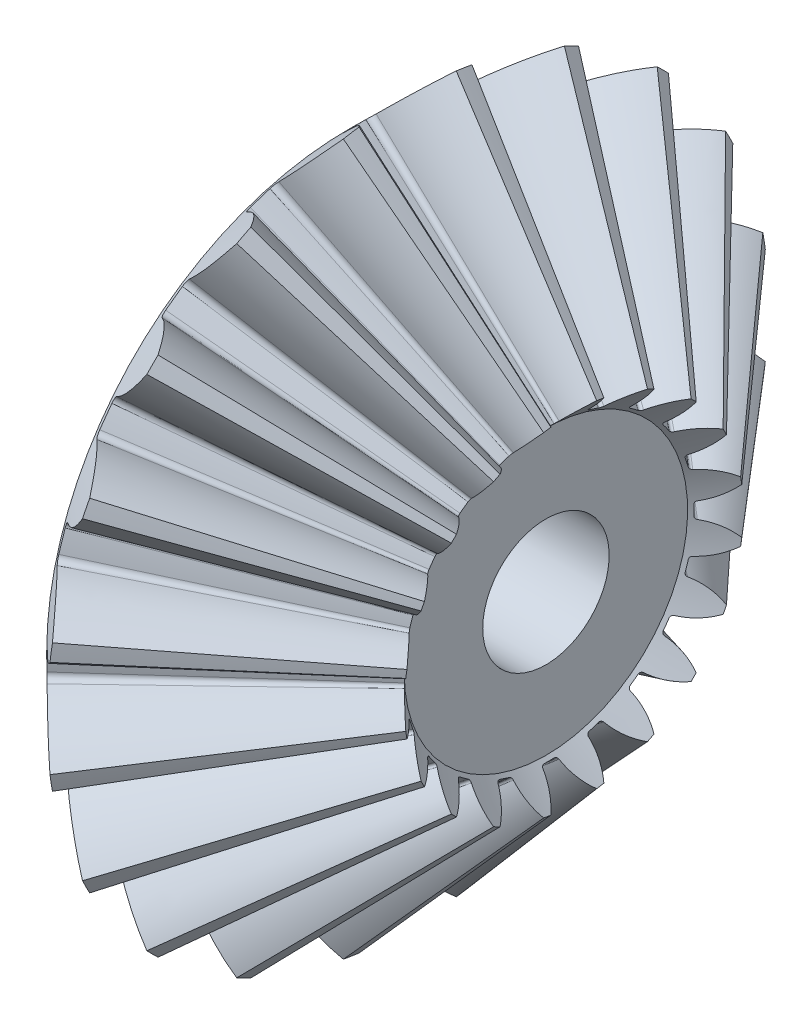
from build123d import *

# Parameters (mm, degrees)
TEETHCUTS_COUNT = 20
TEETHCUTS_ANGLE = 342
HUBSKE_R        = 5
HUB_DEPTH       = 0.0001016
BORSKE_R        = 1.5
BORE_DEPTH      = 8.84097754


with BuildPart() as part:
    # BasProSke → Base-Revolve (revolve)
    with BuildSketch(Plane(origin=(0, 0, 0), x_dir=(1, 0, 0), z_dir=(0, 1, 0)), mode=Mode.PRIVATE) as base_revolve_sk:
        Polygon((0, 0), (0, 7.159073261), (1.406612166, 8.565685424), (5.349252849, 4.023044734), (4.688609434, 3.36240132), (4.688609434, 0), align=None)
    revolve(base_revolve_sk.sketch.rotate(Axis((-10, 0, 0), (1, 0, 0)), 180), axis=Axis((-10, 0, 0), (1, 0, 0)))

    # ToothCut: read off the stored shape, not the designer's step
    # ToothCut: loft between two sections, ruled curve by curve
    toothcut_from = [
        Edge.make_bspline([(8.846968182, 0.006041442, -0.009396371), (8.842747294, 0.001820554, -0.014824058), (8.837070599, -0.003856141, -0.014022911), (8.833691402, -0.007235338, -0.007522631)], [0, 0, 0, 0, 1, 1, 1, 1], 3, [1, 0.779607321, 0.779607321, 1]),
        Edge.make_bspline([(8.833691402, -0.007235338, 0.007522631), (8.837070599, -0.003856141, 0.014022911), (8.842747294, 0.001820554, 0.014824058), (8.846968182, 0.006041442, 0.009396371)], [0, 0, 0, 0, 1, 1, 1, 1], 3, [1, 0.779607321, 0.779607321, 1]),
        Edge.make_bspline([(8.833691402, -0.007235338, -0.007522631), (8.833188772, -0.007737968, -0.006555763), (8.832787408, -0.008139332, -0.005498444), (8.832495307, -0.008431433, -0.00437174)], [0, 0, 0, 0, 1, 1, 1, 1], 3, [1, 0.993359051, 0.993359051, 1]),
        Edge.make_bspline([(8.832495307, -0.008431433, 0.00437174), (8.832787408, -0.008139332, 0.005498444), (8.833188772, -0.007737968, 0.006555763), (8.833691402, -0.007235338, 0.007522631)], [0, 0, 0, 0, 1, 1, 1, 1], 3, [1, 0.993359051, 0.993359051, 1]),
        Edge.make_bspline([(8.832495307, -0.008431433, -0.00437174), (8.831755763, -0.009170977, -0.001519142), (8.831755763, -0.009170977, 0.001519142), (8.832495307, -0.008431433, 0.00437174)], [0, 0, 0, 0, 1, 1, 1, 1], 3, [1, 0.959256539, 0.959256539, 1]),
        Edge.make_line((8.846968182, 0.006041442, 0.009396371), (8.846968182, 0.006041442, -0.009396371)),
    ]
    toothcut_to = [
        Edge.make_bspline([(1.46556069, 8.624633948, -1.28623016), (1.133128031, 8.29220129, -0.817842922), (0.716323315, 7.875396575, -0.512954078), (0.25391972, 7.412992981, -0.399925851)], [0, 0, 0, 0, 1, 1, 1, 1], 3, [1, 0.968991732, 0.968991732, 1]),
        Edge.make_bspline([(0.25391972, 7.412992981, 0.399925851), (0.716323315, 7.875396575, 0.512954078), (1.133128031, 8.29220129, 0.817842922), (1.46556069, 8.624633948, 1.28623016)], [0, 0, 0, 0, 1, 1, 1, 1], 3, [1, 0.968991732, 0.968991732, 1]),
        Edge.make_bspline([(0.25391972, 7.412992981, -0.399925851), (0.198607772, 7.357681033, -0.386405603), (0.16320738, 7.322280641, -0.324800046), (0.165162164, 7.324235425, -0.245465452)], [0, 0, 0, 0, 1, 1, 1, 1], 3, [1, 0.835749277, 0.835749277, 1]),
        Edge.make_bspline([(0.165162164, 7.324235425, 0.245465452), (0.16320738, 7.322280641, 0.324800046), (0.198607772, 7.357681033, 0.386405603), (0.25391972, 7.412992981, 0.399925851)], [0, 0, 0, 0, 1, 1, 1, 1], 3, [1, 0.835749277, 0.835749277, 1]),
        Edge.make_bspline([(0.165162164, 7.324235425, -0.245465452), (0.169193484, 7.328266745, -0.081854918), (0.169193484, 7.328266745, 0.081854918), (0.165162164, 7.324235425, 0.245465452)], [0, 0, 0, 0, 1, 1, 1, 1], 3, [1, 0.999595624, 0.999595624, 1]),
        Edge.make_line((1.46556069, 8.624633948, 1.28623016), (1.46556069, 8.624633948, -1.28623016)),
    ]
    toothcut = Solid(Shell([*[Face.make_surface_from_curves(toothcut_from[k], toothcut_to[k]) for k in range(6)], Face(Wire(toothcut_from)), Face(Wire(toothcut_to))]))
    add(toothcut, mode=Mode.SUBTRACT)

    # TeethCuts: ToothCut ×20 about axis
    teethcuts_axis = Axis((-10, 0, 0), (1, 0, 0))
    for i in range(1, TEETHCUTS_COUNT):
        add(toothcut.rotate(teethcuts_axis, i * TEETHCUTS_ANGLE / (TEETHCUTS_COUNT - 1)), mode=Mode.SUBTRACT)

    # HubSke → Hub (add)
    with BuildSketch(Plane.ZY):
        with Locations(Location((0, 0, 0), (0, 0, 180))):
            Circle(HUBSKE_R)
    extrude(amount=HUB_DEPTH)

    # BorSke → Bore (cut, symmetric)
    with BuildSketch(Plane(origin=(0, 0, 0), x_dir=(0, 0, -1), z_dir=(1, 0, 0))):
        with Locations(Location((0, 0, 0), (0, 0, 180))):
            Circle(BORSKE_R)
    extrude(amount=BORE_DEPTH, both=True, mode=Mode.SUBTRACT)


solid = part.part
